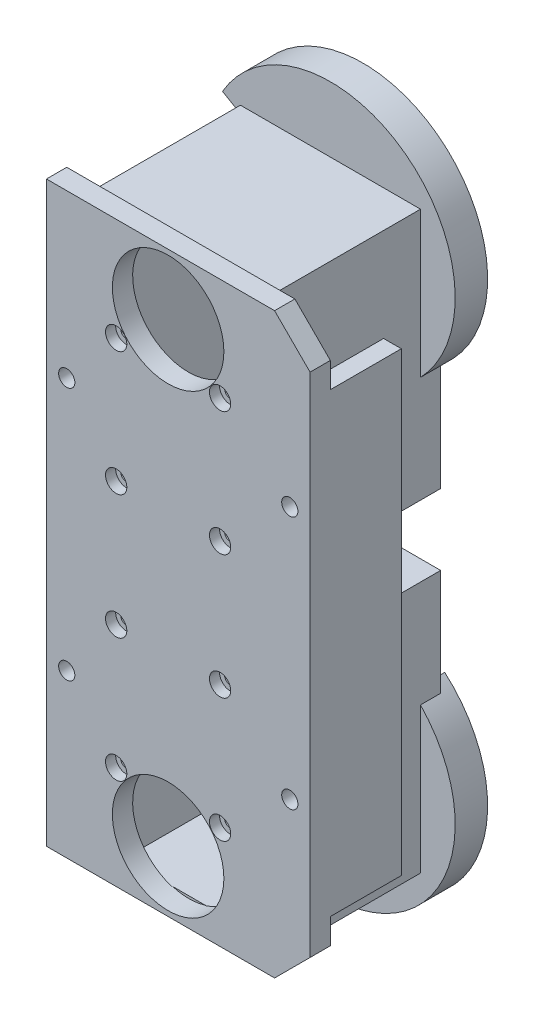
from build123d import *

# Parameters (mm, degrees)
BOSS_1_DEPTH    = 4
S_BOX2_W        = 3.5
S_BOX2_H        = 90
BOSS_2_DEPTH    = 14.5
S_BOX3_W        = 3.5
S_BOX3_H        = 90
BOSS_3_DEPTH    = 14.5
S_BOX4_W        = 35.52
S_BOX4_H        = 2.5
BOSS_4_DEPTH    = 36
S_BOX5_W        = 35.52
S_BOX5_H        = 1.2
BOSS_5_DEPTH    = 36
S_BOX6_W        = 5
S_BOX6_H        = 49.72
BOSS_6_DEPTH    = 36
S_BOX7_W        = 5
S_BOX7_H        = 49.72
BOSS_7_DEPTH    = 36
S_BOX8_W        = 35.52
S_BOX8_H        = 49.72
BOSS_8_DEPTH    = 4
S_CYL9_R        = 19
BOSS_9_DEPTH    = 2.525
BOSS_10_DEPTH   = 6.4
S_BOX11_W       = 35.52
S_BOX11_H       = 1.2
BOSS_11_DEPTH   = 36
S_BOX12_W       = 35.52
S_BOX12_H       = 2.5
BOSS_12_DEPTH   = 36
S_BOX13_W       = 5
S_BOX13_H       = 49.72
BOSS_13_DEPTH   = 36
S_BOX14_W       = 5
S_BOX14_H       = 49.72
BOSS_14_DEPTH   = 36
S_BOX15_W       = 35.52
S_BOX15_H       = 49.72
BOSS_15_DEPTH   = 4
S_CYL16_R       = 19
BOSS_16_DEPTH   = 2.525
BOSS_17_DEPTH   = 6.4
S_HOLE18_R      = 11
HOLE_18_DEPTH   = 4.2
S_HOLE19_R      = 1.1
HOLE_19_DEPTH   = 4.2
S_HOLE20_R      = 2.1
HOLE_20_DEPTH   = 2.1
S_HOLE21_R      = 1.1
HOLE_21_DEPTH   = 4.2
S_HOLE22_R      = 2.1
HOLE_22_DEPTH   = 2.1
S_HOLE23_R      = 1.1
HOLE_23_DEPTH   = 4.2
S_HOLE24_R      = 2.1
HOLE_24_DEPTH   = 2.1
S_HOLE25_R      = 1.1
HOLE_25_DEPTH   = 4.2
S_HOLE26_R      = 2.1
HOLE_26_DEPTH   = 2.1
S_CUT27_W       = 25.52
S_CUT27_H       = 46.02
POCKET_27_DEPTH = 4.075
S_HOLE28_R      = 11.5
HOLE_28_DEPTH   = 2.625
S_HOLE29_R      = 0.9
HOLE_29_DEPTH   = 5.7
S_HOLE30_R      = 0.9
HOLE_30_DEPTH   = 5.7
S_HOLE31_R      = 0.9
HOLE_31_DEPTH   = 5.7
S_HOLE32_R      = 0.9
HOLE_32_DEPTH   = 5.7
S_HOLE33_R      = 11
HOLE_33_DEPTH   = 4.2
S_HOLE34_R      = 1.1
HOLE_34_DEPTH   = 4.2
S_HOLE35_R      = 2.1
HOLE_35_DEPTH   = 2.1
S_HOLE36_R      = 1.1
HOLE_36_DEPTH   = 4.2
S_HOLE37_R      = 2.1
HOLE_37_DEPTH   = 2.1
S_HOLE38_R      = 1.1
HOLE_38_DEPTH   = 4.2
S_HOLE39_R      = 2.1
HOLE_39_DEPTH   = 2.1
S_HOLE40_R      = 1.1
HOLE_40_DEPTH   = 4.2
S_HOLE41_R      = 2.1
HOLE_41_DEPTH   = 2.1
S_CUT42_W       = 25.52
S_CUT42_H       = 46.02
POCKET_42_DEPTH = 4.075
S_HOLE43_R      = 11.5
HOLE_43_DEPTH   = 2.625
S_HOLE44_R      = 0.9
HOLE_44_DEPTH   = 5.7
S_HOLE45_R      = 0.9
HOLE_45_DEPTH   = 5.7
S_HOLE46_R      = 0.9
HOLE_46_DEPTH   = 5.7
S_HOLE47_R      = 0.9
HOLE_47_DEPTH   = 5.7
S_HOLE48_R      = 1.6
HOLE_48_DEPTH   = 4.2
S_HOLE49_R      = 1.6
HOLE_49_DEPTH   = 4.2
S_HOLE50_R      = 1.6
HOLE_50_DEPTH   = 4.2
S_HOLE51_R      = 1.6
HOLE_51_DEPTH   = 4.2


with BuildPart() as part:
    # S_prism1 → Boss_1 (new body)
    with BuildSketch(Plane.XY.offset(64.625)):
        Polygon((28, -50), (28, 50), (21, 57), (-24, 57), (-24, -57), (21, -57), align=None)
    extrude(amount=BOSS_1_DEPTH)

    # S_box2 → Boss_2 (add)
    with BuildSketch(Plane.XY.offset(50.625)):
        with Locations((26.25, 0)):
            Rectangle(S_BOX2_W, S_BOX2_H)
    extrude(amount=BOSS_2_DEPTH)

    # S_box3 → Boss_3 (add)
    with BuildSketch(Plane.XY.offset(50.625)):
        with Locations((-22.25, 0)):
            Rectangle(S_BOX3_W, S_BOX3_H)
    extrude(amount=BOSS_3_DEPTH)

    # S_box4 → Boss_4 (add)
    with BuildSketch(Plane.XY.offset(32.625)):
        with Locations((0, 8.24)):
            Rectangle(S_BOX4_W, S_BOX4_H)
    extrude(amount=BOSS_4_DEPTH)

    # S_box5 → Boss_5 (add)
    with BuildSketch(Plane.XY.offset(32.625)):
        with Locations((0, 56.11)):
            Rectangle(S_BOX5_W, S_BOX5_H)
    extrude(amount=BOSS_5_DEPTH)

    # S_box6 → Boss_6 (add)
    with BuildSketch(Plane.XY.offset(32.625)):
        with Locations((-15.26, 31.85)):
            Rectangle(S_BOX6_W, S_BOX6_H)
    extrude(amount=BOSS_6_DEPTH)

    # S_box7 → Boss_7 (add)
    with BuildSketch(Plane.XY.offset(32.625)):
        with Locations((15.26, 31.85)):
            Rectangle(S_BOX7_W, S_BOX7_H)
    extrude(amount=BOSS_7_DEPTH)

    # S_box8 → Boss_8 (add)
    with BuildSketch(Plane.XY.offset(64.625)):
        with Locations((0, 31.85)):
            Rectangle(S_BOX8_W, S_BOX8_H)
    extrude(amount=BOSS_8_DEPTH)

    # S_cyl9 → Boss_9 (add)
    with BuildSketch(Plane.XY.offset(30.1)):
        with Locations((0, 45)):
            Circle(S_CYL9_R)
    extrude(amount=BOSS_9_DEPTH)

    # S_prism10 → Boss_10 (add)
    with BuildSketch(Plane.XY.offset(30.2)):
        with BuildLine():
            Line((-21.304224933, 57.3), (-9.526279442, 50.5))
            ThreePointArc((-9.526279442, 50.5), (6.996860423, 53.487870417), (7.216649319, 36.698194618))
            Line((7.216649319, 36.698194618), (16.139052113, 26.434144327))
            ThreePointArc((16.139052113, 26.434144327), (15.647524219, 63.981964751), (-21.304224933, 57.3))
        make_face()
    extrude(amount=BOSS_10_DEPTH)

    # S_box11 → Boss_11 (add)
    with BuildSketch(Plane.XY.offset(32.625)):
        with Locations((0, -56.11)):
            Rectangle(S_BOX11_W, S_BOX11_H)
    extrude(amount=BOSS_11_DEPTH)

    # S_box12 → Boss_12 (add)
    with BuildSketch(Plane.XY.offset(32.625)):
        with Locations((0, -8.24)):
            Rectangle(S_BOX12_W, S_BOX12_H)
    extrude(amount=BOSS_12_DEPTH)

    # S_box13 → Boss_13 (add)
    with BuildSketch(Plane.XY.offset(32.625)):
        with Locations((-15.26, -31.85)):
            Rectangle(S_BOX13_W, S_BOX13_H)
    extrude(amount=BOSS_13_DEPTH)

    # S_box14 → Boss_14 (add)
    with BuildSketch(Plane.XY.offset(32.625)):
        with Locations((15.26, -31.85)):
            Rectangle(S_BOX14_W, S_BOX14_H)
    extrude(amount=BOSS_14_DEPTH)

    # S_box15 → Boss_15 (add)
    with BuildSketch(Plane.XY.offset(64.625)):
        with Locations((0, -31.85)):
            Rectangle(S_BOX15_W, S_BOX15_H)
    extrude(amount=BOSS_15_DEPTH)

    # S_cyl16 → Boss_16 (add)
    with BuildSketch(Plane.XY.offset(30.1)):
        with Locations((0, -45)):
            Circle(S_CYL16_R)
    extrude(amount=BOSS_16_DEPTH)

    # S_prism17 → Boss_17 (add)
    with BuildSketch(Plane.XY.offset(30.2)):
        with BuildLine():
            Line((16.139052113, -26.434144327), (7.216649319, -36.698194618))
            ThreePointArc((7.216649319, -36.698194618), (6.996860423, -53.487870417), (-9.526279442, -50.5))
            Line((-9.526279442, -50.5), (-21.304224933, -57.3))
            ThreePointArc((-21.304224933, -57.3), (15.647524219, -63.981964751), (16.139052113, -26.434144327))
        make_face()
    extrude(amount=BOSS_17_DEPTH)

    # S_hole18 → Hole_18 (cut)
    with BuildSketch(Plane.XY.offset(64.525)):
        with Locations((0, 45)):
            Circle(S_HOLE18_R)
    extrude(amount=HOLE_18_DEPTH, mode=Mode.SUBTRACT)

    # S_hole19 → Hole_19 (cut)
    with BuildSketch(Plane.XY.offset(64.525)):
        with Locations((-10.25, 36.7)):
            Circle(S_HOLE19_R)
    extrude(amount=HOLE_19_DEPTH, mode=Mode.SUBTRACT)

    # S_hole20 → Hole_20 (cut)
    with BuildSketch(Plane.XY.offset(66.625)):
        with Locations((-10.25, 36.7)):
            Circle(S_HOLE20_R)
    extrude(amount=HOLE_20_DEPTH, mode=Mode.SUBTRACT)

    # S_hole21 → Hole_21 (cut)
    with BuildSketch(Plane.XY.offset(64.525)):
        with Locations((10.25, 36.7)):
            Circle(S_HOLE21_R)
    extrude(amount=HOLE_21_DEPTH, mode=Mode.SUBTRACT)

    # S_hole22 → Hole_22 (cut)
    with BuildSketch(Plane.XY.offset(66.625)):
        with Locations((10.25, 36.7)):
            Circle(S_HOLE22_R)
    extrude(amount=HOLE_22_DEPTH, mode=Mode.SUBTRACT)

    # S_hole23 → Hole_23 (cut)
    with BuildSketch(Plane.XY.offset(64.525)):
        with Locations((-10.25, 12.25)):
            Circle(S_HOLE23_R)
    extrude(amount=HOLE_23_DEPTH, mode=Mode.SUBTRACT)

    # S_hole24 → Hole_24 (cut)
    with BuildSketch(Plane.XY.offset(66.625)):
        with Locations((-10.25, 12.25)):
            Circle(S_HOLE24_R)
    extrude(amount=HOLE_24_DEPTH, mode=Mode.SUBTRACT)

    # S_hole25 → Hole_25 (cut)
    with BuildSketch(Plane.XY.offset(64.525)):
        with Locations((10.25, 12.25)):
            Circle(S_HOLE25_R)
    extrude(amount=HOLE_25_DEPTH, mode=Mode.SUBTRACT)

    # S_hole26 → Hole_26 (cut)
    with BuildSketch(Plane.XY.offset(66.625)):
        with Locations((10.25, 12.25)):
            Circle(S_HOLE26_R)
    extrude(amount=HOLE_26_DEPTH, mode=Mode.SUBTRACT)

    # S_cut27 → Pocket_27 (cut)
    with BuildSketch(Plane.XY.offset(32.625)):
        with Locations((0, 32.5)):
            Rectangle(S_CUT27_W, S_CUT27_H)
    extrude(amount=POCKET_27_DEPTH, mode=Mode.SUBTRACT)

    # S_hole28 → Hole_28 (cut)
    with BuildSketch(Plane.XY.offset(30.1)):
        with Locations((0, 45)):
            Circle(S_HOLE28_R)
    extrude(amount=HOLE_28_DEPTH, mode=Mode.SUBTRACT)

    # S_hole29 → Hole_29 (cut)
    with BuildSketch(Plane.XY.offset(30.1)):
        with Locations((19.938771315, 35.702398242)):
            Circle(S_HOLE29_R)
    extrude(amount=HOLE_29_DEPTH, mode=Mode.SUBTRACT)

    # S_hole30 → Hole_30 (cut)
    with BuildSketch(Plane.XY.offset(30.1)):
        with Locations((21.250368178, 50.694018992)):
            Circle(S_HOLE30_R)
    extrude(amount=HOLE_30_DEPTH, mode=Mode.SUBTRACT)

    # S_hole31 → Hole_31 (cut)
    with BuildSketch(Plane.XY.offset(30.1)):
        with Locations((12.6186816, 63.021344974)):
            Circle(S_HOLE31_R)
    extrude(amount=HOLE_31_DEPTH, mode=Mode.SUBTRACT)

    # S_hole32 → Hole_32 (cut)
    with BuildSketch(Plane.XY.offset(30.1)):
        with Locations((0.767788927, 66.986598194)):
            Circle(S_HOLE32_R)
    extrude(amount=HOLE_32_DEPTH, mode=Mode.SUBTRACT)

    # S_hole33 → Hole_33 (cut)
    with BuildSketch(Plane.XY.offset(64.525)):
        with Locations((0, -45)):
            Circle(S_HOLE33_R)
    extrude(amount=HOLE_33_DEPTH, mode=Mode.SUBTRACT)

    # S_hole34 → Hole_34 (cut)
    with BuildSketch(Plane.XY.offset(64.525)):
        with Locations((-10.25, -36.7)):
            Circle(S_HOLE34_R)
    extrude(amount=HOLE_34_DEPTH, mode=Mode.SUBTRACT)

    # S_hole35 → Hole_35 (cut)
    with BuildSketch(Plane.XY.offset(66.625)):
        with Locations((-10.25, -36.7)):
            Circle(S_HOLE35_R)
    extrude(amount=HOLE_35_DEPTH, mode=Mode.SUBTRACT)

    # S_hole36 → Hole_36 (cut)
    with BuildSketch(Plane.XY.offset(64.525)):
        with Locations((10.25, -36.7)):
            Circle(S_HOLE36_R)
    extrude(amount=HOLE_36_DEPTH, mode=Mode.SUBTRACT)

    # S_hole37 → Hole_37 (cut)
    with BuildSketch(Plane.XY.offset(66.625)):
        with Locations((10.25, -36.7)):
            Circle(S_HOLE37_R)
    extrude(amount=HOLE_37_DEPTH, mode=Mode.SUBTRACT)

    # S_hole38 → Hole_38 (cut)
    with BuildSketch(Plane.XY.offset(64.525)):
        with Locations((-10.25, -12.25)):
            Circle(S_HOLE38_R)
    extrude(amount=HOLE_38_DEPTH, mode=Mode.SUBTRACT)

    # S_hole39 → Hole_39 (cut)
    with BuildSketch(Plane.XY.offset(66.625)):
        with Locations((-10.25, -12.25)):
            Circle(S_HOLE39_R)
    extrude(amount=HOLE_39_DEPTH, mode=Mode.SUBTRACT)

    # S_hole40 → Hole_40 (cut)
    with BuildSketch(Plane.XY.offset(64.525)):
        with Locations((10.25, -12.25)):
            Circle(S_HOLE40_R)
    extrude(amount=HOLE_40_DEPTH, mode=Mode.SUBTRACT)

    # S_hole41 → Hole_41 (cut)
    with BuildSketch(Plane.XY.offset(66.625)):
        with Locations((10.25, -12.25)):
            Circle(S_HOLE41_R)
    extrude(amount=HOLE_41_DEPTH, mode=Mode.SUBTRACT)

    # S_cut42 → Pocket_42 (cut)
    with BuildSketch(Plane.XY.offset(32.625)):
        with Locations((0, -32.5)):
            Rectangle(S_CUT42_W, S_CUT42_H)
    extrude(amount=POCKET_42_DEPTH, mode=Mode.SUBTRACT)

    # S_hole43 → Hole_43 (cut)
    with BuildSketch(Plane.XY.offset(30.1)):
        with Locations((0, -45)):
            Circle(S_HOLE43_R)
    extrude(amount=HOLE_43_DEPTH, mode=Mode.SUBTRACT)

    # S_hole44 → Hole_44 (cut)
    with BuildSketch(Plane.XY.offset(30.1)):
        with Locations((19.938771315, -35.702398242)):
            Circle(S_HOLE44_R)
    extrude(amount=HOLE_44_DEPTH, mode=Mode.SUBTRACT)

    # S_hole45 → Hole_45 (cut)
    with BuildSketch(Plane.XY.offset(30.1)):
        with Locations((21.250368178, -50.694018992)):
            Circle(S_HOLE45_R)
    extrude(amount=HOLE_45_DEPTH, mode=Mode.SUBTRACT)

    # S_hole46 → Hole_46 (cut)
    with BuildSketch(Plane.XY.offset(30.1)):
        with Locations((12.6186816, -63.021344974)):
            Circle(S_HOLE46_R)
    extrude(amount=HOLE_46_DEPTH, mode=Mode.SUBTRACT)

    # S_hole47 → Hole_47 (cut)
    with BuildSketch(Plane.XY.offset(30.1)):
        with Locations((0.767788927, -66.986598194)):
            Circle(S_HOLE47_R)
    extrude(amount=HOLE_47_DEPTH, mode=Mode.SUBTRACT)

    # S_hole48 → Hole_48 (cut)
    with BuildSketch(Plane.XY.offset(64.525)):
        with Locations((-20, -25)):
            Circle(S_HOLE48_R)
    extrude(amount=HOLE_48_DEPTH, mode=Mode.SUBTRACT)

    # S_hole49 → Hole_49 (cut)
    with BuildSketch(Plane.XY.offset(64.525)):
        with Locations((-20, 25)):
            Circle(S_HOLE49_R)
    extrude(amount=HOLE_49_DEPTH, mode=Mode.SUBTRACT)

    # S_hole50 → Hole_50 (cut)
    with BuildSketch(Plane.XY.offset(64.525)):
        with Locations((24, -25)):
            Circle(S_HOLE50_R)
    extrude(amount=HOLE_50_DEPTH, mode=Mode.SUBTRACT)

    # S_hole51 → Hole_51 (cut)
    with BuildSketch(Plane.XY.offset(64.525)):
        with Locations((24, 25)):
            Circle(S_HOLE51_R)
    extrude(amount=HOLE_51_DEPTH, mode=Mode.SUBTRACT)


solid = part.part
